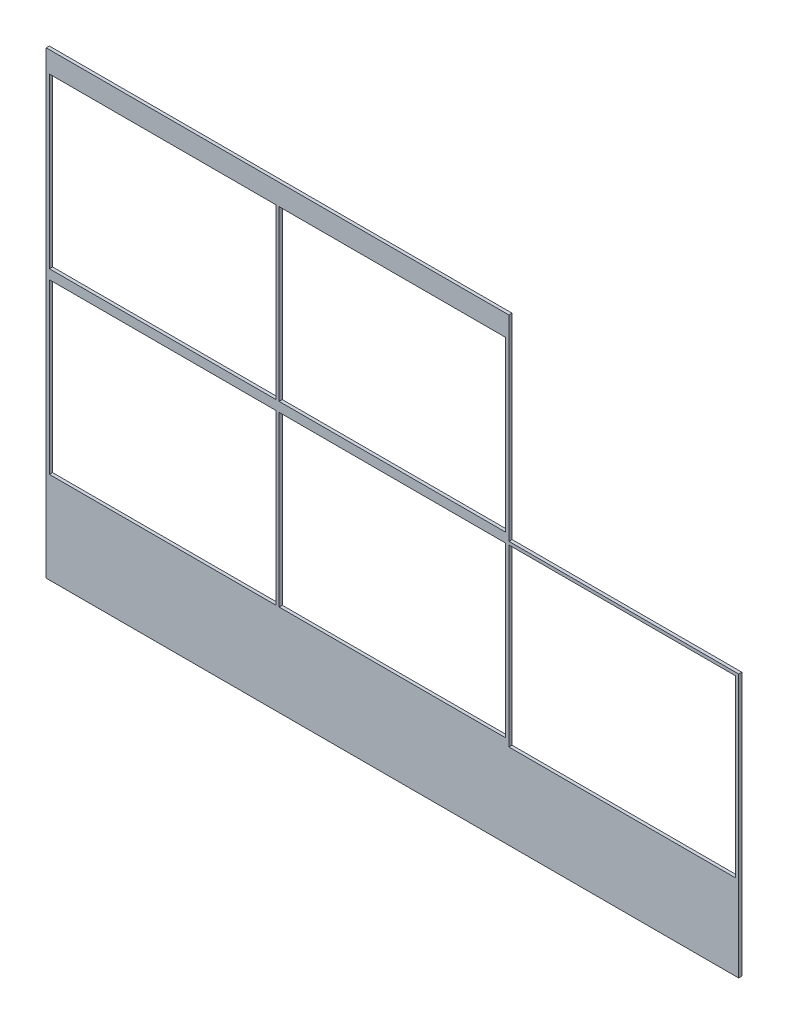
from build123d import *

# Parameters (mm, degrees)
EXTRUDE_1_DEPTH             = 6
SKETCH_2_W                  = 430
SKETCH_2_H                  = 320
CUT_EXTRUDE_1_DEPTH         = 985.706372479
PATTERN_LINEAR_1_COUNT      = 2
PATTERN_LINEAR_1_PITCH      = 436
PATTERN_LINEAR_1_COUNT_DIR2 = 2
PATTERN_LINEAR_1_PITCH_DIR2 = 338
SKETCH_3_W                  = 430
SKETCH_3_H                  = 332
CUT_EXTRUDE_2_DEPTH         = 985.706372479


with BuildPart() as part:
    # Эскиз1 → Бобышка-Вытянуть1 (new body)
    with BuildSketch(Plane.XY):
        Polygon((-431, -435.8), (-431, 435.8), (447, 435.8), (447, 63.8), (883, 63.8), (883, -435.8), align=None)
    extrude(amount=-EXTRUDE_1_DEPTH)

    # Эскиз2 → Вырез-Вытянуть1 (cut, through all)
    with BuildSketch(Plane(origin=(0, 0, -6), x_dir=(-1, 0, 0), z_dir=(0, 0, -1))):
        with Locations((-226, 235.8)):
            Rectangle(SKETCH_2_W, SKETCH_2_H)
    cut_extrude_1 = extrude(amount=-CUT_EXTRUDE_1_DEPTH, mode=Mode.SUBTRACT)

    # Линейный массив1: Cut-Extrude 1 2 × 2
    with Locations(*[(-i * PATTERN_LINEAR_1_PITCH, -j * PATTERN_LINEAR_1_PITCH_DIR2, 0) for i in range(PATTERN_LINEAR_1_COUNT) for j in range(PATTERN_LINEAR_1_COUNT_DIR2) if (i, j) != (0, 0)]):
        add(cut_extrude_1, mode=Mode.SUBTRACT)

    # Эскиз3 → Вырез-Вытянуть2 (cut, through all)
    with BuildSketch(Plane.XY):
        with Locations((662, -108.2)):
            Rectangle(SKETCH_3_W, SKETCH_3_H)
    extrude(amount=-CUT_EXTRUDE_2_DEPTH, mode=Mode.SUBTRACT)


solid = part.part
